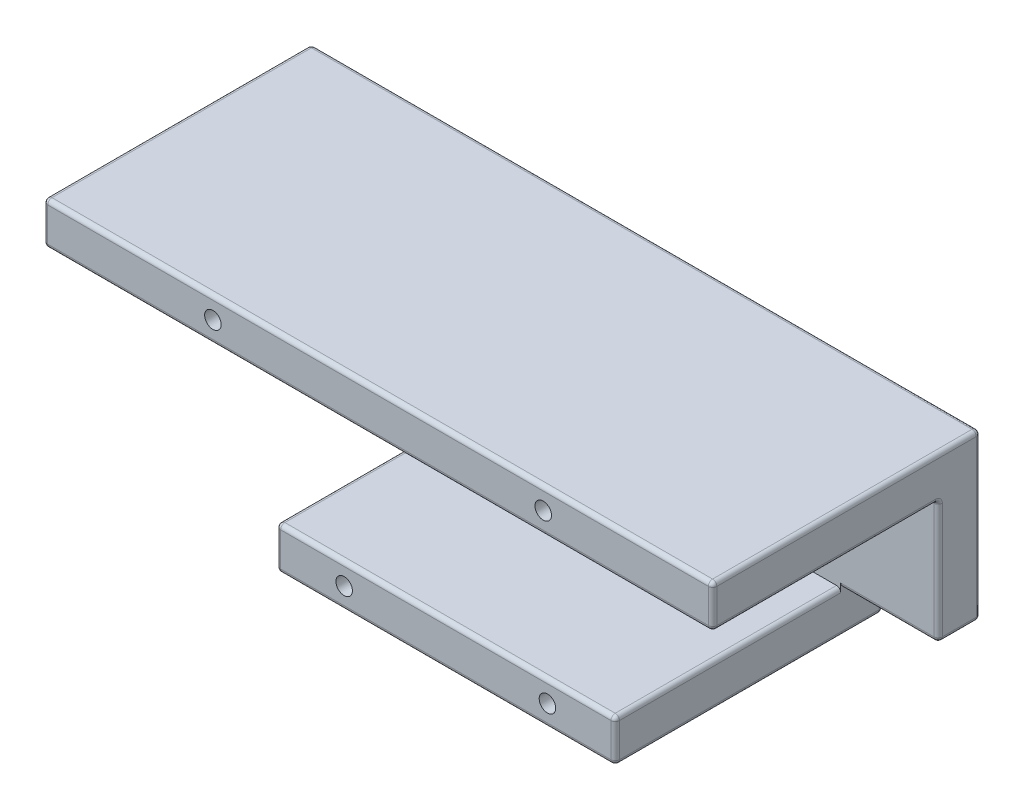
from build123d import *

# Parameters (mm, degrees)
EXTRUDE_3_DEPTH     = 1.7
SKETCH_4_R          = 0.81
EXTRUDE_4_DEPTH     = 3.7
SKETCH_5_W          = 79
SKETCH_5_H          = 14.47
EXTRUDE_5_DEPTH     = 5
SKETCH_6_W          = 79
SKETCH_6_H          = 31.63
EXTRUDE_6_DEPTH     = 5
FILLET_1_R          = 0.31
FILLET_2_R          = 0.5
FILLET_3_R          = 0.5
FILLET_5_R          = 0.5
SKETCH_8_W          = 40
SKETCH_8_H          = 31.63
EXTRUDE_7_DEPTH     = 5
FILLET_6_R          = 0.5
SKETCH_9_R          = 0.975
CUT_EXTRUDE_1_DEPTH = 5
FILLET_7_R          = 0.5


with BuildPart() as part:
    # 草图1 → 凸台-拉伸3 (new body)
    with BuildSketch(Plane.XY):
        with BuildLine():
            Line((0, 1.75), (55.5, 1.75))
            ThreePointArc((55.5, 1.75), (57.25, 0), (55.5, -1.75))
            Line((55.5, -1.75), (0, -1.75))
            ThreePointArc((0, -1.75), (-1.75, 0), (0, 1.75))
        make_face()
    extrude(amount=EXTRUDE_3_DEPTH)

    # 草图4 → 凸台-拉伸4 (add)
    with BuildSketch(Plane(origin=(0, 0, 0), x_dir=(-1, 0, 0), z_dir=(0, 0, -1))):
        Circle(SKETCH_4_R)
        with Locations((-55.5, 0)):
            Circle(SKETCH_4_R)
    extrude(amount=-EXTRUDE_4_DEPTH)

    # 草图5 → 凸台-拉伸5 (add)
    with BuildSketch(Plane(origin=(0, 0, 0), x_dir=(-1, 0, 0), z_dir=(0, 0, -1))):
        with Locations((-27.5, -1.005)):
            Rectangle(SKETCH_5_W, SKETCH_5_H)
    extrude(amount=EXTRUDE_5_DEPTH)

    # 草图6 → 凸台-拉伸6 (add)
    with BuildSketch(Plane(origin=(0, 6.23, 0), x_dir=(1, 0, 0), z_dir=(0, 1, 0))):
        with Locations((27.5, -10.815)):
            Rectangle(SKETCH_6_W, SKETCH_6_H)
    extrude(amount=EXTRUDE_6_DEPTH)

    # 圆角1
    fillet_1_edges = [part.edges().sort_by_distance(p)[0] for p in [
        (27.5, 6.23, 0),
    ]]
    fillet(fillet_1_edges, radius=FILLET_1_R)

    # 圆角2
    fillet_2_edges = [part.edges().sort_by_distance(p)[0] for p in [
        (67, -8.24, -2.5),
    ]]
    fillet(fillet_2_edges, radius=FILLET_2_R)

    # 圆角3
    fillet_3_edges = [part.edges().sort_by_distance(p)[0] for p in [
        (-12, -8.24, -2.5),
    ]]
    fillet(fillet_3_edges, radius=FILLET_3_R)

    # 圆角5
    fillet_5_edges = [part.edges().sort_by_distance(p)[0] for p in [
        (67, 11.23, 10.815),
    ]]
    fillet(fillet_5_edges, radius=FILLET_5_R)

    # 草图8 → 凸台-拉伸7 (add)
    with BuildSketch(Plane(origin=(0, -8.24, 0), x_dir=(-1, 0, 0), z_dir=(0, -1, 0))):
        with Locations((-35.5, -10.815)):
            Rectangle(SKETCH_8_W, SKETCH_8_H)
    extrude(amount=EXTRUDE_7_DEPTH)

    # 圆角6
    fillet_6_edges = [part.edges().sort_by_distance(p)[0] for p in [
        (67, 8.48, 26.63),
        (66.853553391, 11.083553391, 26.63),
        (2, -8.24, -5),
        (-11.853553391, -8.093553391, -5),
        (27.25, 11.23, -5),
        (66.853553391, 11.083553391, -5),
        (61, -8.24, -5),
        (66.853553391, -8.093553391, -5),
        (27.5, 6.23, 26.63),
        (-12, 8.73, 26.63),
        (27.25, 11.23, 26.63),
        (-12, 11.23, 10.815),
        (15.5, -8.24, 13.315),
        (15.5, -10.74, 26.63),
        (35.5, -8.24, 26.63),
        (55.5, -8.24, 13.315),
        (55.5, -10.74, 26.63),
        (55.5, -13.24, 10.815),
        (35.5, -13.24, 26.63),
        (15.5, -13.24, 10.815),
        (15.5, -10.74, -5),
        (-12, 1.745, -5),
        (55.5, -10.74, -5),
        (35.5, -13.24, -5),
        (67, 1.495, -5),
    ]]
    fillet(fillet_6_edges, radius=FILLET_6_R)

    # 草图9 → 切除-拉伸1 (cut)
    with BuildSketch(Plane.XY.offset(26.63)):
        with Locations((23.5, -10.74)):
            Circle(SKETCH_9_R)
        with Locations((47.5, -10.74)):
            Circle(SKETCH_9_R)
        with Locations((8, 8.73)):
            Circle(SKETCH_9_R)
        with Locations((47, 8.73)):
            Circle(SKETCH_9_R)
    extrude(amount=-CUT_EXTRUDE_1_DEPTH, mode=Mode.SUBTRACT)

    # 圆角7
    # the kernel refuses this fillet: 0.5 mm, written as the material it takes off along each edge
    with BuildSketch(Plane(origin=(-11.5, 6.73, 26.13), x_dir=(-1, 0, 0), z_dir=(0, -1, 0))) as fillet_7_piece_1_section:
        Polygon((0, 0), (FILLET_7_R * 1.02, 0), (FILLET_7_R * 1.02, -FILLET_7_R * 1.02), (0, -FILLET_7_R * 1.02), align=None)
    fillet_7_piece_1 = extrude(amount=FILLET_7_R * 1.02, mode=Mode.PRIVATE)
    fillet_7_piece_1 = fillet_7_piece_1 - Plane(origin=(-11.5, 6.73, 26.13), x_dir=(0.7071067811865475, 0, -0.7071067811865475), z_dir=(0, -1, 0)) * Sphere(FILLET_7_R, mode=Mode.PRIVATE)
    add(fillet_7_piece_1, mode=Mode.SUBTRACT)
    with BuildSketch(Plane(origin=(66.5, 6.73, 26.13), x_dir=(0, -1, 0), z_dir=(1, 0, 0))) as fillet_7_piece_2_section:
        Polygon((0, 0), (FILLET_7_R * 1.02, 0), (FILLET_7_R * 1.02, -FILLET_7_R * 1.02), (0, -FILLET_7_R * 1.02), align=None)
    fillet_7_piece_2 = extrude(amount=FILLET_7_R * 1.02, mode=Mode.PRIVATE)
    fillet_7_piece_2 = fillet_7_piece_2 - Plane(origin=(66.5, 6.73, 26.13), x_dir=(0, 0.7071067811865475, -0.7071067811865475), z_dir=(1, 0, 0)) * Sphere(FILLET_7_R, mode=Mode.PRIVATE)
    add(fillet_7_piece_2, mode=Mode.SUBTRACT)
    with BuildSketch(Plane(origin=(-12, 5.92, 0), x_dir=(1, 0, 0), z_dir=(0, -1, 0))) as fillet_7_piece_3:
        with BuildLine():
            CenterArc((FILLET_7_R, -FILLET_7_R), FILLET_7_R, 90, 90)
            Line((0, -FILLET_7_R), (0, 0))
            Line((0, 0), (FILLET_7_R, 0))
        make_face()
    extrude(amount=13.66, mode=Mode.SUBTRACT)
    with BuildSketch(Plane(origin=(67, -7.74, 0), x_dir=(0, 0, -1), z_dir=(0, 1, 0))) as fillet_7_piece_4:
        with BuildLine():
            CenterArc((FILLET_7_R, FILLET_7_R), FILLET_7_R, 180, 90)
            Line((0, FILLET_7_R), (0, 0))
            Line((0, 0), (FILLET_7_R, 0))
        make_face()
    extrude(amount=13.66, mode=Mode.SUBTRACT)
    with BuildSketch(Plane(origin=(-12, 6.23, 26.13), x_dir=(1, 0, 0), z_dir=(0, 0, -1))) as fillet_7_piece_5:
        with BuildLine():
            CenterArc((FILLET_7_R, -FILLET_7_R), FILLET_7_R, 90, 90)
            Line((0, -FILLET_7_R), (0, 0))
            Line((0, 0), (FILLET_7_R, 0))
        make_face()
    extrude(amount=25.82, mode=Mode.SUBTRACT)
    with BuildSketch(Plane(origin=(-12, 5.92, 0.31), x_dir=(0, 0, -1), z_dir=(0, -1, 0))) as fillet_7_piece_6:
        with BuildLine():
            CenterArc((0.31 + FILLET_7_R, FILLET_7_R), FILLET_7_R, 180, 90)
            Line((0.31 + FILLET_7_R, 0), (0.31, 0))
            Line((0.31, 0), (0.31, FILLET_7_R))
        make_face()
    revolve(axis=Axis((-12, 5.92, 0.31), (1, 0, 0)), revolution_arc=90, mode=Mode.SUBTRACT)
    with BuildSketch(Plane(origin=(67, 5.92, 0.31), x_dir=(0, 0, -1), z_dir=(0, -1, 0))) as fillet_7_piece_7:
        with BuildLine():
            CenterArc((0.31 + FILLET_7_R, -FILLET_7_R), FILLET_7_R, 90, 90)
            Line((0.31, -FILLET_7_R), (0.31, 0))
            Line((0.31, 0), (0.31 + FILLET_7_R, 0))
        make_face()
    revolve(axis=Axis((67, 5.92, 0.31), (1, 0, 0)), revolution_arc=90, mode=Mode.SUBTRACT)
    with BuildSketch(Plane(origin=(55.5, -8.24, 0), x_dir=(0, 1, 0), z_dir=(1, 0, 0))) as fillet_7_piece_8:
        with BuildLine():
            CenterArc((FILLET_7_R, -FILLET_7_R), FILLET_7_R, 90, 90)
            Line((0, -FILLET_7_R), (0, 0))
            Line((0, 0), (FILLET_7_R, 0))
        make_face()
    extrude(amount=11, mode=Mode.SUBTRACT)
    with BuildSketch(Plane(origin=(66.5, -7.74, 0), x_dir=(1, 0, 0), z_dir=(0, 1, 0))) as fillet_7_piece_9:
        with BuildLine():
            CenterArc((0.5 - FILLET_7_R, FILLET_7_R), FILLET_7_R, 270, 90)
            Line((0.5 - FILLET_7_R, 0), (0.5, 0))
            Line((0.5, 0), (0.5, FILLET_7_R))
        make_face()
    revolve(axis=Axis((66.5, -7.74, 0), (0, 0, -1)), revolution_arc=90, mode=Mode.SUBTRACT)
    with BuildSketch(Plane(origin=(-11.5, -7.74, 0), x_dir=(0, -1, 0), z_dir=(1, 0, 0))) as fillet_7_piece_10:
        with BuildLine():
            CenterArc((0.5 - FILLET_7_R, FILLET_7_R), FILLET_7_R, 270, 90)
            Line((0.5, FILLET_7_R), (0.5, 0))
            Line((0.5, 0), (0.5 - FILLET_7_R, 0))
        make_face()
    revolve(axis=Axis((-11.5, -7.74, 0), (0, 0, -1)), revolution_arc=90, mode=Mode.SUBTRACT)
    with BuildSketch(Plane(origin=(-11.5, -8.24, 0), x_dir=(0, 1, 0), z_dir=(1, 0, 0))) as fillet_7_piece_11:
        with BuildLine():
            CenterArc((FILLET_7_R, -FILLET_7_R), FILLET_7_R, 90, 90)
            Line((0, -FILLET_7_R), (0, 0))
            Line((0, 0), (FILLET_7_R, 0))
        make_face()
    extrude(amount=27, mode=Mode.SUBTRACT)
    with BuildSketch(Plane(origin=(67, 6.23, 0.31), x_dir=(0, 1, 0), z_dir=(0, 0, 1))) as fillet_7_piece_12:
        with BuildLine():
            CenterArc((FILLET_7_R, FILLET_7_R), FILLET_7_R, 180, 90)
            Line((0, FILLET_7_R), (0, 0))
            Line((0, 0), (FILLET_7_R, 0))
        make_face()
    extrude(amount=25.82, mode=Mode.SUBTRACT)


solid = part.part
